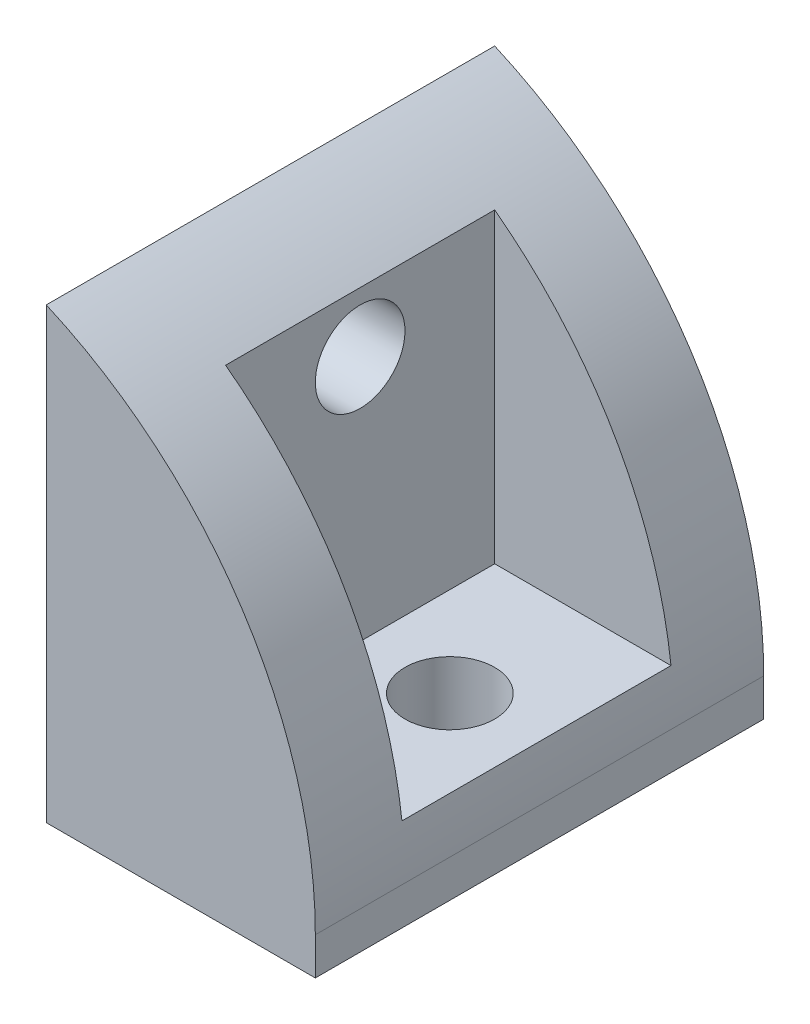
from build123d import *

# Parameters (mm, degrees)
CROQUIS1_W              = 4
CROQUIS1_H              = 6
CROQUIS1_R              = 1
SALIENTE_EXTRUIR1_DEPTH = 2
SALIENTE_EXTRUIR2_DEPTH = 8
CROQUIS2_R              = 1
CORTAR_EXTRUIR1_DEPTH   = 14.416407865
REDONDEO1_R             = 10


with BuildPart() as part:
    # Croquis1 → Saliente-Extruir1 (new body)
    # profile 1 of 2: a face of its own
    with BuildSketch(Plane(origin=(0, 0, 0), x_dir=(1, 0, 0), z_dir=(0, 1, 0))):
        with Locations((4, 5)):
            Rectangle(CROQUIS1_W, CROQUIS1_H)
        with Locations(Location((4, 5, 0), (0, 0, 270))):
            Circle(CROQUIS1_R, mode=Mode.SUBTRACT)
    # profile 2 of 2: a face of its own
    with BuildSketch(Plane(origin=(0, 0, 0), x_dir=(1, 0, 0), z_dir=(0, 1, 0))):
        Polygon((6, 0), (6, 2), (2, 2), (2, 8), (6, 8), (6, 10), (0, 10), (0, 0), align=None)
    extrude(amount=-SALIENTE_EXTRUIR1_DEPTH)

    # Croquis1<3> → Saliente-Extruir2 (add)
    with BuildSketch(Plane(origin=(0, 0, 0), x_dir=(1, 0, 0), z_dir=(0, 1, 0))):
        Polygon((6, 0), (6, 2), (2, 2), (2, 8), (6, 8), (6, 10), (0, 10), (0, 0), align=None)
    extrude(amount=SALIENTE_EXTRUIR2_DEPTH)

    # Croquis2 → Cortar-Extruir1 (cut, through all)
    with BuildSketch(Plane(origin=(2, 0, 0), x_dir=(0, 0, -1), z_dir=(1, 0, 0))):
        with Locations((5, 5.5)):
            Circle(CROQUIS2_R)
    extrude(amount=-CORTAR_EXTRUIR1_DEPTH, mode=Mode.SUBTRACT)

    # Redondeo1
    # the kernel refuses this fillet: 10 mm, written as the material it takes off along each edge
    with BuildSketch(Plane(origin=(6, 8, 22.912878475), x_dir=(0, -1, 0), z_dir=(0, 0, -1))) as redondeo1_piece_1:
        with BuildLine():
            CenterArc((9.16515139, 10), REDONDEO1_R, 203.578178478, 66.421821522)
            Line((0, 6), (-0.183303028, 5.92))
            ThreePointArc((-0.183303028, 5.92), (-0.2, 3), (-0.2, 0))
            Line((-0.2, 0), (0, -0.2))
            Line((0, -0.2), (9.16515139, -0.2))
            Line((9.16515139, -0.2), (9.16515139, 0))
        make_face()
    extrude(amount=47.82575695, mode=Mode.SUBTRACT)


solid = part.part
